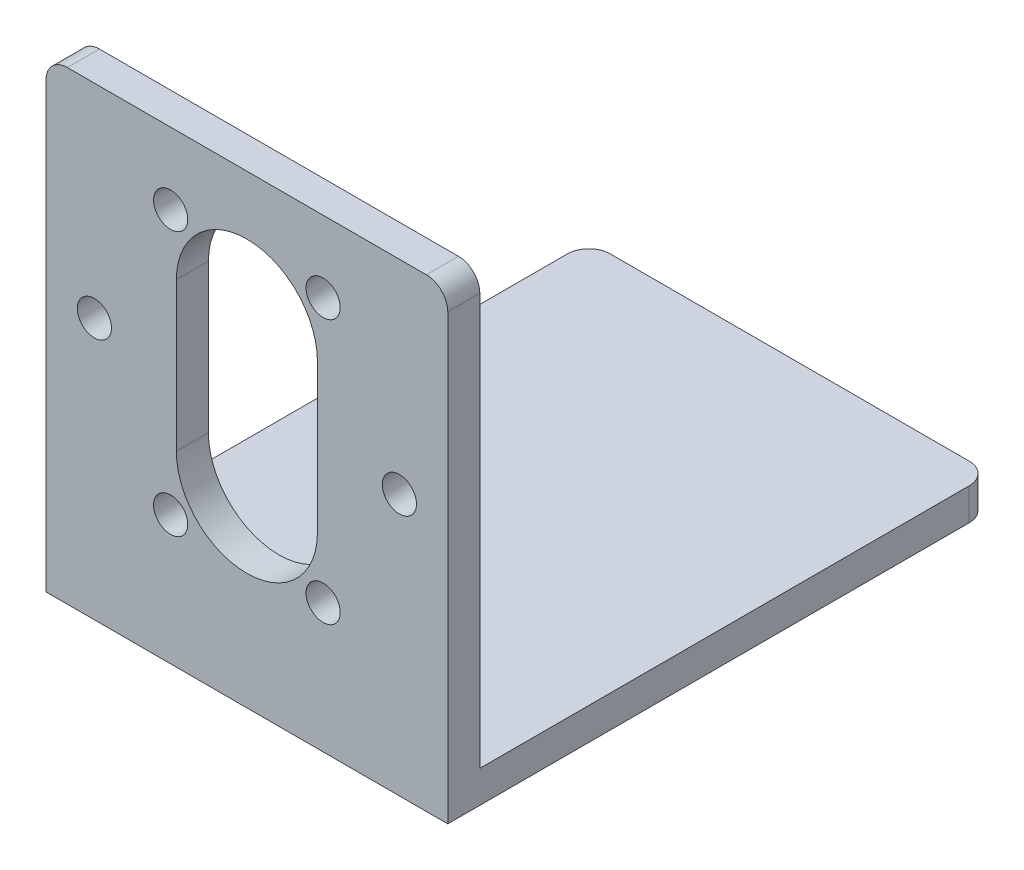
from build123d import *

# Parameters (mm, degrees)
BOSS_EXTRUDE1_DEPTH      = 3
BOSS_EXTRUDE2_DEPTH      = 1.5
BOSS_EXTRUDE2_DEPTH_BACK = 1.5
SKETCH2_W                = 37.6
SKETCH2_H                = 50.8
FILLET2_R                = 2
CUT_EXTRUDE2_REACH       = 70.543
SKETCH4_R                = 1.6


with BuildPart() as part:
    # Sketch1 → Boss-Extrude1 (new body)
    with BuildSketch(Plane.XY):
        Polygon((-18.8, 0), (18.8, 0), (18.8, 22), (18.8, 42), (-18.8, 42), (-18.8, 22), align=None)
        with BuildLine():
            Line((-6.6, 15.99997774), (-6.6, 29.89997774))
            ThreePointArc((-6.6, 29.89997774), (0, 36.5), (6.6, 29.89997774))
            Line((6.6, 29.89997774), (6.6, 15.99997774))
            ThreePointArc((6.6, 15.99997774), (0, 9.4), (-6.6, 15.99997774))
        make_face(mode=Mode.SUBTRACT)
    extrude(amount=BOSS_EXTRUDE1_DEPTH)

    # Sketch2 → Boss-Extrude2 (add, two sides: drawn at the far end of the back side and taken through both)
    with BuildSketch(Plane.XZ.offset(-BOSS_EXTRUDE2_DEPTH_BACK)):
        with Locations((0, -22.4)):
            Rectangle(SKETCH2_W, SKETCH2_H)
    extrude(amount=BOSS_EXTRUDE2_DEPTH + BOSS_EXTRUDE2_DEPTH_BACK)

    # Fillet2
    fillet2_edges = [part.edges().sort_by_distance(p)[0] for p in [
        (-18.8, 0, -47.8),
        (18.8, 0, -47.8),
        (-18.8, 42, 1.5),
        (18.8, 42, 1.5),
    ]]
    fillet(fillet2_edges, radius=FILLET2_R)

    # Sketch4 → Cut-Extrude2 (cut, up to next)
    with BuildSketch(Plane.XY.offset(3), mode=Mode.PRIVATE) as cut_extrude2_sk1:
        with Locations((7.135405883, 35.308885523)):
            Circle(SKETCH4_R)
    cut_extrude2_tool1 = extrude(cut_extrude2_sk1.sketch, amount=-CUT_EXTRUDE2_REACH, mode=Mode.PRIVATE) & part.part
    # Sketch4 → Cut-Extrude2 (cut, up to next)
    with BuildSketch(Plane.XY.offset(3), mode=Mode.PRIVATE) as cut_extrude2_sk2:
        with Locations((14.270811767, 22.95)):
            Circle(SKETCH4_R)
    cut_extrude2_tool2 = extrude(cut_extrude2_sk2.sketch, amount=-CUT_EXTRUDE2_REACH, mode=Mode.PRIVATE) & part.part
    # Sketch4 → Cut-Extrude2 (cut, up to next)
    with BuildSketch(Plane.XY.offset(3), mode=Mode.PRIVATE) as cut_extrude2_sk3:
        with Locations((7.135405883, 10.591114477)):
            Circle(SKETCH4_R)
    cut_extrude2_tool3 = extrude(cut_extrude2_sk3.sketch, amount=-CUT_EXTRUDE2_REACH, mode=Mode.PRIVATE) & part.part
    # Sketch4 → Cut-Extrude2 (cut, up to next)
    with BuildSketch(Plane.XY.offset(3), mode=Mode.PRIVATE) as cut_extrude2_sk4:
        with Locations((-7.135405883, 10.591114477)):
            Circle(SKETCH4_R)
    cut_extrude2_tool4 = extrude(cut_extrude2_sk4.sketch, amount=-CUT_EXTRUDE2_REACH, mode=Mode.PRIVATE) & part.part
    # Sketch4 → Cut-Extrude2 (cut, up to next)
    with BuildSketch(Plane.XY.offset(3), mode=Mode.PRIVATE) as cut_extrude2_sk5:
        with Locations((-14.270811767, 22.95)):
            Circle(SKETCH4_R)
    cut_extrude2_tool5 = extrude(cut_extrude2_sk5.sketch, amount=-CUT_EXTRUDE2_REACH, mode=Mode.PRIVATE) & part.part
    # Sketch4 → Cut-Extrude2 (cut, up to next)
    with BuildSketch(Plane.XY.offset(3), mode=Mode.PRIVATE) as cut_extrude2_sk6:
        with Locations((-7.135405883, 35.308885523)):
            Circle(SKETCH4_R)
    cut_extrude2_tool6 = extrude(cut_extrude2_sk6.sketch, amount=-CUT_EXTRUDE2_REACH, mode=Mode.PRIVATE) & part.part
    add(cut_extrude2_tool1.solids().sort_by_distance((7.135406, 35.308886, 3))[0], mode=Mode.SUBTRACT)
    add(cut_extrude2_tool2.solids().sort_by_distance((14.270812, 22.95, 3))[0], mode=Mode.SUBTRACT)
    add(cut_extrude2_tool3.solids().sort_by_distance((7.135406, 10.591114, 3))[0], mode=Mode.SUBTRACT)
    add(cut_extrude2_tool4.solids().sort_by_distance((-7.135406, 10.591114, 3))[0], mode=Mode.SUBTRACT)
    add(cut_extrude2_tool5.solids().sort_by_distance((-14.270812, 22.95, 3))[0], mode=Mode.SUBTRACT)
    add(cut_extrude2_tool6.solids().sort_by_distance((-7.135406, 35.308886, 3))[0], mode=Mode.SUBTRACT)


solid = part.part
